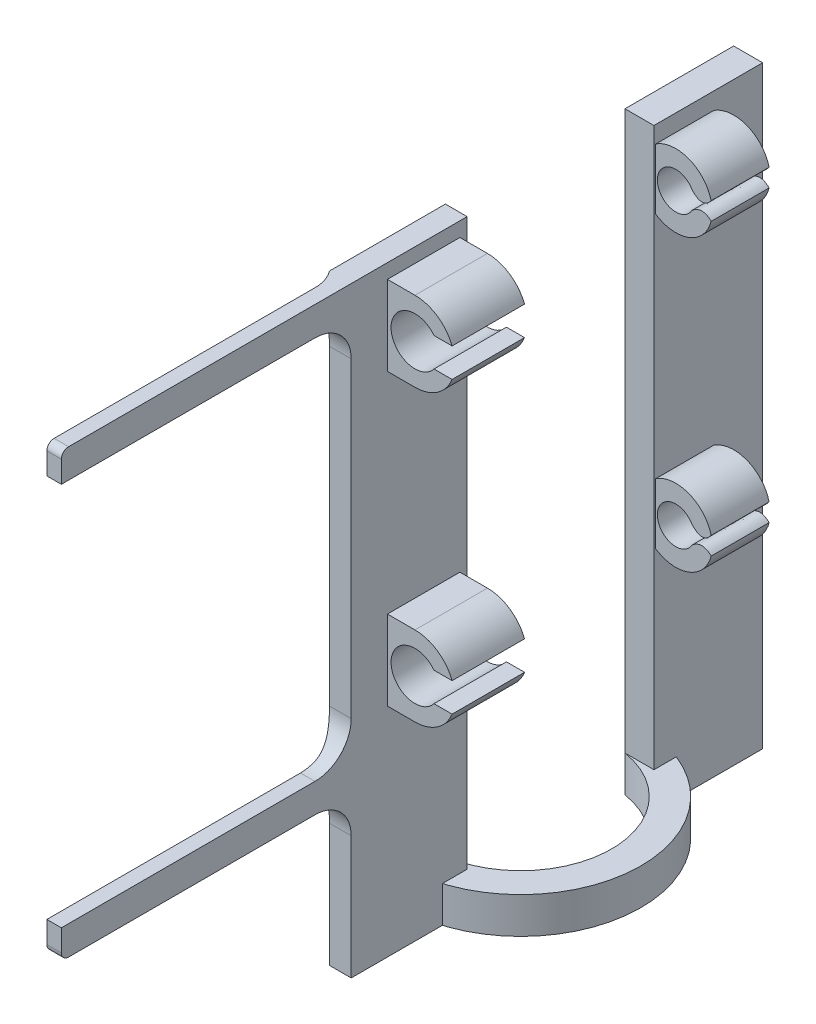
from build123d import *

# Parameters (mm, degrees)
BOSS_EXTRUDE1_DEPTH     = 10
BOSS_EXTRUDE1_2_DEPTH   = 10
SKETCH2_W               = 16
SKETCH2_H               = 63
BOSS_EXTRUDE2_DEPTH     = 3
BOSS_EXTRUDE3_DEPTH     = 5
SKETCH5_W               = 4
SKETCH5_H               = 15
BOSS_EXTRUDE4_DEPTH     = 82
BOSS_EXTRUDE5_START     = 26
SKETCH7_R               = 5.029708881
BOSS_EXTRUDE5_DEPTH     = 8
SKETCH6_R               = 2.55
CUT_EXTRUDE1_DEPTH      = 32
CUT_EXTRUDE2_DEPTH      = 10
CUT_EXTRUDE2_DEPTH_BACK = 2
LPATTERN1_COUNT         = 2
LPATTERN1_PITCH         = 40
SKETCH9_W               = 2
SKETCH9_H               = 4
BOSS_EXTRUDE6_DEPTH     = 40
FILLET1_R               = 5
FILLET2_R               = 1


with BuildPart() as part:
    # Sketch1 → Boss-Extrude1 (new body)
    with BuildSketch(Plane.XY):
        with BuildLine():
            Line((0, 5.5), (-3.799215788, 5.5))
            Line((-3.799215788, 5.5), (-3.799215788, -5.5))
            Line((-3.799215788, -5.5), (0, -5.5))
            ThreePointArc((0, -5.5), (3.102418411, -4.541475531), (5.123475383, -2))
            Line((5.123475383, -2), (2.62488095, -2))
            ThreePointArc((2.62488095, -2), (-3.3, 0), (2.62488095, 2))
            Line((2.62488095, 2), (5.123475383, 2))
            ThreePointArc((5.123475383, 2), (3.102418411, 4.541475531), (0, 5.5))
        make_face()
    extrude(amount=BOSS_EXTRUDE1_DEPTH)



with BuildPart() as body_2:
    # Sketch1 → Boss-Extrude1 2 (new body)
    with BuildSketch(Plane.XY):
        with BuildLine():
            Line((2.62488095, -38), (5.123475383, -38))
            ThreePointArc((5.123475383, -38), (3.102418411, -35.458524469), (0, -34.5))
            Line((0, -34.5), (-3.799215788, -34.5))
            Line((-3.799215788, -34.5), (-3.799215788, -45.5))
            Line((-3.799215788, -45.5), (0, -45.5))
            ThreePointArc((0, -45.5), (3.102418411, -44.541475531), (5.123475383, -42))
            Line((5.123475383, -42), (2.62488095, -42))
            ThreePointArc((2.62488095, -42), (-3.3, -40), (2.62488095, -38))
        make_face()
    extrude(amount=BOSS_EXTRUDE1_2_DEPTH)


with BuildPart() as part_1:
    add(part.part)

    add(body_2.part)  # Boss-Extrude2 merges body 2
    # Sketch2 → Boss-Extrude2 (add)
    with BuildSketch(Plane.ZY.offset(3.799215788)):
        with Locations((7, -24)):
            Rectangle(SKETCH2_W, SKETCH2_H)
    extrude(amount=BOSS_EXTRUDE2_DEPTH)

    # Sketch3 → section 1 of loft1
    with BuildSketch(Plane(origin=(0, -75.5, 0), x_dir=(-1, 0, 0), z_dir=(0, -1, 0)), mode=Mode.PRIVATE) as loft1_s1:
        with BuildLine():
            Line((6.799215788, 1), (3.799215788, 1))
            Line((3.799215788, 1), (3.799215788, -15))
            Line((3.799215788, -15), (6.799215788, -15))
            Line((6.799215788, -15), (6.799215788, 1))
        make_face()
    # loft from a face of the part (loft1)
    loft([part_1.faces().sort_by_distance((-5.299215788, -55.5, 7))[0], loft1_s1.sketch])

    # Sketch9 → Boss-Extrude6 (add)
    with BuildSketch(Plane.XY.offset(15)):
        with Locations((-4.799215788, 5.5)):
            Rectangle(SKETCH9_W, SKETCH9_H)
        with Locations((-4.799215788, -51.5)):
            Rectangle(SKETCH9_W, SKETCH9_H)
    extrude(amount=BOSS_EXTRUDE6_DEPTH)

    # Fillet1
    # the kernel refuses this fillet: 5 mm, written as the material it adds along each edge
    with BuildSketch(Plane(origin=(-5.799215788, 7.5, 15), x_dir=(0, 0, 1), z_dir=(0, -1, 0))) as fillet1_piece_1:
        with BuildLine():
            CenterArc((3, 5), FILLET1_R, 233.130102354, 36.869897646)
            Line((0, 1), (-0.06, 0.92))
            ThreePointArc((-0.06, 0.92), (-0.1, 0.5), (-0.1, 0))
            Line((-0.1, 0), (0, -0.1))
            Line((0, -0.1), (3, -0.1))
            Line((3, -0.1), (3, 0))
        make_face()
    extrude(amount=4)
    with BuildSketch(Plane(origin=(-5.799215788, -53.5, 15), x_dir=(0, 0, 1), z_dir=(0, 1, 0))) as fillet1_piece_2:
        with BuildLine():
            CenterArc((3, -5), FILLET1_R, 90, 36.869897646)
            Line((0, -1), (-0.06, -0.92))
            ThreePointArc((-0.06, -0.92), (-0.1, -0.5), (-0.1, 0))
            Line((-0.1, 0), (0, 0.1))
            Line((0, 0.1), (3, 0.1))
            Line((3, 0.1), (3, 0))
        make_face()
    extrude(amount=4)
    with BuildSketch(Plane(origin=(-5.799215788, -49.5, 15), x_dir=(0, 0, 1), z_dir=(1, 0, 0)), Plane(origin=(-3.799215788, -53.5, 15), x_dir=(0, 0, 1), z_dir=(-1, 0, 0))) as fillet1_piece_3:
        with BuildLine():
            CenterArc((FILLET1_R, -FILLET1_R), FILLET1_R, 90, 90)
            Line((0, -FILLET1_R), (-FILLET1_R * 0.02, -FILLET1_R))
            Line((-FILLET1_R * 0.02, -FILLET1_R), (-FILLET1_R * 0.02, FILLET1_R * 0.02))
            Line((-FILLET1_R * 0.02, FILLET1_R * 0.02), (FILLET1_R, FILLET1_R * 0.02))
            Line((FILLET1_R, FILLET1_R * 0.02), (FILLET1_R, 0))
        make_face()
    extrude(amount=2)
    with BuildSketch(Plane(origin=(-5.799215788, 3.5, 15), x_dir=(0, 0, 1), z_dir=(1, 0, 0))) as fillet1_piece_4:
        with BuildLine():
            CenterArc((FILLET1_R, FILLET1_R), FILLET1_R, 180, 90)
            Line((0, FILLET1_R), (-FILLET1_R * 0.02, FILLET1_R))
            Line((-FILLET1_R * 0.02, FILLET1_R), (-FILLET1_R * 0.02, -FILLET1_R * 0.02))
            Line((-FILLET1_R * 0.02, -FILLET1_R * 0.02), (FILLET1_R, -FILLET1_R * 0.02))
            Line((FILLET1_R, -FILLET1_R * 0.02), (FILLET1_R, 0))
        make_face()
    extrude(amount=2)
    with BuildSketch(Plane(origin=(-18.299215788, 3.5, 15), x_dir=(0, 0, 1), z_dir=(1, 0, 0))) as fillet1_piece_5a_section:
        with BuildLine():
            CenterArc((FILLET1_R, FILLET1_R), FILLET1_R, 180, 90)
            Line((0, FILLET1_R), (-FILLET1_R * 0.02, FILLET1_R))
            Line((-FILLET1_R * 0.02, FILLET1_R), (-FILLET1_R * 0.02, -FILLET1_R * 0.02))
            Line((-FILLET1_R * 0.02, -FILLET1_R * 0.02), (FILLET1_R, -FILLET1_R * 0.02))
            Line((FILLET1_R, -FILLET1_R * 0.02), (FILLET1_R, 0))
        make_face()
    fillet1_piece_5a = extrude(amount=14.5, mode=Mode.PRIVATE)
    fillet1_piece_5a = split(fillet1_piece_5a, bisect_by=Plane(origin=(-5.799215788, 2.368024429, 16.131975571), z_dir=(-1, 0, 0)), keep=Keep.TOP, mode=Mode.PRIVATE)
    fillet1_piece_5a = split(fillet1_piece_5a, bisect_by=Plane(origin=(-6.799215788, 2.368024429, 16.131975571), z_dir=(1, 0, 0)), keep=Keep.TOP, mode=Mode.PRIVATE)
    with BuildSketch(Plane(origin=(-5.799215788, 7.5, 15), x_dir=(0, 0, 1), z_dir=(0, -1, 0))) as fillet1_piece_5b_section:
        with BuildLine():
            CenterArc((3, 5), FILLET1_R, 233.130102354, 36.869897646)
            Line((0, 1), (-0.06, 0.92))
            ThreePointArc((-0.06, 0.92), (-0.1, 0.5), (-0.1, 0))
            Line((-0.1, 0), (0, -0.1))
            Line((0, -0.1), (3, -0.1))
            Line((3, -0.1), (3, 0))
        make_face()
    fillet1_piece_5b = extrude(amount=11.5, mode=Mode.PRIVATE)
    fillet1_piece_5b = split(fillet1_piece_5b, bisect_by=Plane(origin=(-6.025404186, 3.5, 15.849672813), z_dir=(0, -1, 0)), keep=Keep.TOP, mode=Mode.PRIVATE)
    fillet1_piece_5 = fillet1_piece_5a & fillet1_piece_5b
    add(fillet1_piece_5)
    with BuildSketch(Plane(origin=(-3.799215788, -53.5, 15), x_dir=(0, 0, 1), z_dir=(-1, 0, 0))) as fillet1_piece_6a_section:
        with BuildLine():
            CenterArc((FILLET1_R, -FILLET1_R), FILLET1_R, 90, 90)
            Line((0, -FILLET1_R), (-FILLET1_R * 0.02, -FILLET1_R))
            Line((-FILLET1_R * 0.02, -FILLET1_R), (-FILLET1_R * 0.02, FILLET1_R * 0.02))
            Line((-FILLET1_R * 0.02, FILLET1_R * 0.02), (FILLET1_R, FILLET1_R * 0.02))
            Line((FILLET1_R, FILLET1_R * 0.02), (FILLET1_R, 0))
        make_face()
    fillet1_piece_6a = extrude(amount=14.5, mode=Mode.PRIVATE)
    fillet1_piece_6a = split(fillet1_piece_6a, bisect_by=Plane(origin=(-5.799215788, -54.631975571, 16.131975571), z_dir=(-1, 0, 0)), keep=Keep.TOP, mode=Mode.PRIVATE)
    fillet1_piece_6a = split(fillet1_piece_6a, bisect_by=Plane(origin=(-6.799215788, -54.631975571, 16.131975571), z_dir=(1, 0, 0)), keep=Keep.TOP, mode=Mode.PRIVATE)
    with BuildSketch(Plane(origin=(-5.799215788, -61, 15), x_dir=(0, 0, 1), z_dir=(0, 1, 0))) as fillet1_piece_6b_section:
        with BuildLine():
            CenterArc((3, -5), FILLET1_R, 90, 36.869897646)
            Line((0, -1), (-0.06, -0.92))
            ThreePointArc((-0.06, -0.92), (-0.1, -0.5), (-0.1, 0))
            Line((-0.1, 0), (0, 0.1))
            Line((0, 0.1), (3, 0.1))
            Line((3, 0.1), (3, 0))
        make_face()
    fillet1_piece_6b = extrude(amount=11.5, mode=Mode.PRIVATE)
    fillet1_piece_6b = split(fillet1_piece_6b, bisect_by=Plane(origin=(-6.025404186, -53.5, 15.849672813), z_dir=(0, -1, 0)), keep=Keep.TOP, mode=Mode.PRIVATE)
    fillet1_piece_6 = fillet1_piece_6a & fillet1_piece_6b
    add(fillet1_piece_6)
    with BuildSketch(Plane(origin=(-5.799215788, -53.5, 15), x_dir=(0, 0, 1), z_dir=(0, 1, 0))) as fillet1_piece_7a_section:
        with BuildLine():
            CenterArc((3, -5), FILLET1_R, 90, 36.869897646)
            Line((0, -1), (-0.06, -0.92))
            ThreePointArc((-0.06, -0.92), (-0.1, -0.5), (-0.1, 0))
            Line((-0.1, 0), (0, 0.1))
            Line((0, 0.1), (3, 0.1))
            Line((3, 0.1), (3, 0))
        make_face()
    fillet1_piece_7a = extrude(amount=11.5, mode=Mode.PRIVATE)
    fillet1_piece_7a = split(fillet1_piece_7a, bisect_by=Plane(origin=(-6.025404186, -49.5, 15.849672813), z_dir=(0, 1, 0)), keep=Keep.TOP, mode=Mode.PRIVATE)
    with BuildSketch(Plane(origin=(-18.299215788, -49.5, 15), x_dir=(0, 0, 1), z_dir=(1, 0, 0))) as fillet1_piece_7b_section:
        with BuildLine():
            CenterArc((FILLET1_R, -FILLET1_R), FILLET1_R, 90, 90)
            Line((0, -FILLET1_R), (-FILLET1_R * 0.02, -FILLET1_R))
            Line((-FILLET1_R * 0.02, -FILLET1_R), (-FILLET1_R * 0.02, FILLET1_R * 0.02))
            Line((-FILLET1_R * 0.02, FILLET1_R * 0.02), (FILLET1_R, FILLET1_R * 0.02))
            Line((FILLET1_R, FILLET1_R * 0.02), (FILLET1_R, 0))
        make_face()
    fillet1_piece_7b = extrude(amount=14.5, mode=Mode.PRIVATE)
    fillet1_piece_7b = split(fillet1_piece_7b, bisect_by=Plane(origin=(-5.799215788, -48.368024429, 16.131975571), z_dir=(-1, 0, 0)), keep=Keep.TOP, mode=Mode.PRIVATE)
    fillet1_piece_7b = split(fillet1_piece_7b, bisect_by=Plane(origin=(-6.799215788, -48.368024429, 16.131975571), z_dir=(1, 0, 0)), keep=Keep.TOP, mode=Mode.PRIVATE)
    fillet1_piece_7 = fillet1_piece_7a & fillet1_piece_7b
    add(fillet1_piece_7)

    # Fillet2
    fillet2_edges = [part_1.edges().sort_by_distance(p)[0] for p in [
        (-4.799215788, 7.5, 55),
        (-4.799215788, -53.5, 55),
    ]]
    fillet(fillet2_edges, radius=FILLET2_R)


with BuildPart() as body_2_2:
    # Sketch4 → Boss-Extrude3 (new body)
    with BuildSketch(Plane.XZ.offset(75.5)):
        with BuildLine():
            Line((-6.799215788, 3.081354008), (-6.799215788, -1))
            ThreePointArc((-6.799215788, -1), (3.750784212, -13.389612585), (-6.799215788, -25.779225169))
            Line((-6.799215788, -25.779225169), (-6.799215788, -29.860579178))
            ThreePointArc((-6.799215788, -29.860579178), (7.792732274, -13.389612585), (-6.799215788, 3.081354008))
        make_face()
    extrude(amount=-BOSS_EXTRUDE3_DEPTH)

    # Sketch5 → Boss-Extrude4 (add)
    with BuildSketch(Plane.XZ.offset(75.5)):
        with Locations((-4.799215788, -33.279225169)):
            Rectangle(SKETCH5_W, SKETCH5_H)
    extrude(amount=-BOSS_EXTRUDE4_DEPTH)


with BuildPart() as body_3:
    # Sketch7 → Boss-Extrude5 (new body)
    with BuildSketch(Plane(origin=(0, 0, 0), x_dir=(-1, 0, 0), z_dir=(0, 0, -1)).offset(BOSS_EXTRUDE5_START)):
        Circle(SKETCH7_R)
    extrude(amount=BOSS_EXTRUDE5_DEPTH)

    # Sketch6 → Cut-Extrude1 (cut)
    with BuildSketch(Plane(origin=(0, 0, 0), x_dir=(-1, 0, 0), z_dir=(0, 0, -1))):
        Circle(SKETCH6_R)
    extrude(amount=CUT_EXTRUDE1_DEPTH, mode=Mode.SUBTRACT)

    # Sketch8 → Cut-Extrude2 (cut, two sides: drawn at the far end of the back side and taken through both)
    with BuildSketch(Plane.XY.offset(-32).offset(-CUT_EXTRUDE2_DEPTH_BACK)):
        with BuildLine():
            Line((4.8880156, -1.25), (6.306665545, -1.25))
            Line((6.306665545, -1.25), (6.306665545, 1.25))
            Line((6.306665545, 1.25), (4.8880156, 1.25))
            add(Edge.make_bspline(
                [(4.8880156, 1.25), (3.688676314, -0.372376085), (2.222611077, 1.25)],
                knots=[0, 0, 0, 1, 1, 1], degree=2))
            Line((2.222611077, 1.25), (1.045365469, 1.25))
            ThreePointArc((1.045365469, 1.25), (-1.629505742, 0), (1.045365469, -1.25))
            Line((1.045365469, -1.25), (2.222611077, -1.25))
            add(Edge.make_bspline(
                [(4.8880156, -1.25), (3.642215678, -0.016247262), (2.222611077, -1.25)],
                knots=[0, 0, 0, 1, 1, 1], degree=2))
        make_face()
    extrude(amount=CUT_EXTRUDE2_DEPTH + CUT_EXTRUDE2_DEPTH_BACK, mode=Mode.SUBTRACT)


with BuildPart() as lpattern1_1:
    # LPattern1: pattern copy
    add(body_3.part.moved(Location(Vector(0, -1, 0) * (1 * LPATTERN1_PITCH))))


solid = Compound([part_1.part, body_2_2.part, body_3.part, lpattern1_1.part])
